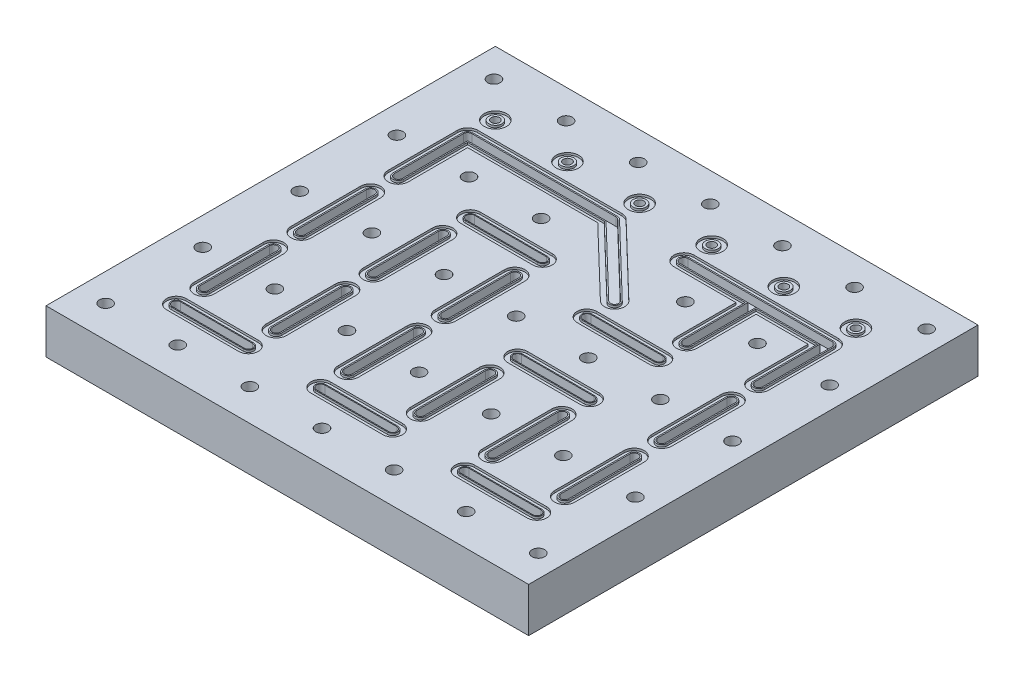
from build123d import *

# Parameters (mm, degrees)
SKETCH1_W                                            = 276.225
SKETCH1_H                                            = 257.175
BOSS_EXTRUDE1_DEPTH                                  = 25.4
SKETCH66_R                                           = 2.38125
CUT_EXTRUDE15_DEPTH                                  = 4.7625
SKETCH67_R                                           = 6.4008
SKETCH67_R_2                                         = 3.7338
CUT_EXTRUDE16_DEPTH                                  = 1.2446
CBORE_FOR_1_4_BINDING_HEAD_MACHINE_SCREW_D           = 7.14248
CBORE_FOR_1_4_BINDING_HEAD_MACHINE_SCREW_CBORE_D     = 14.2875
CBORE_FOR_1_4_BINDING_HEAD_MACHINE_SCREW_CBORE_DEPTH = 4.191


with BuildPart() as part:
    # Sketch1 → Boss-Extrude1 (new body)
    with BuildSketch(Plane(origin=(0, 0, 0), x_dir=(1, 0, 0), z_dir=(0, 1, 0))):
        Rectangle(SKETCH1_W, SKETCH1_H)
    extrude(amount=BOSS_EXTRUDE1_DEPTH)

    # Sketch66 → Cut-Extrude15 (cut)
    with BuildSketch(Plane(origin=(0, 25.4, 0), x_dir=(1, 0, 0), z_dir=(0, 1, 0))):
        with BuildLine():
            Line((-20.009108216, 73.81875), (20.574534869, 34.796016264))
            ThreePointArc((20.574534869, 34.796016264), (23.941483736, 34.862034869), (23.875465131, 38.228983736))
            Line((23.875465131, 38.228983736), (-17.399534869, 77.916483736))
            ThreePointArc((-17.399534869, 77.916483736), (-18.160344261, 78.408815119), (-19.05, 78.58125))
            Line((-19.05, 78.58125), (-101.6, 78.58125))
            ThreePointArc((-101.6, 78.58125), (-103.283798023, 77.883798023), (-103.98125, 76.2))
            Line((-103.98125, 76.2), (-103.98125, 36.5125))
            ThreePointArc((-103.98125, 36.5125), (-101.6, 34.13125), (-99.21875, 36.5125))
            Line((-99.21875, 36.5125), (-99.21875, 73.81875))
            Line((-99.21875, 73.81875), (-20.009108216, 73.81875))
        make_face()
        with BuildLine():
            ThreePointArc((-99.21875, 20.6375), (-101.6, 23.01875), (-103.98125, 20.6375))
            Line((-103.98125, 20.6375), (-103.98125, -19.05))
            ThreePointArc((-103.98125, -19.05), (-101.6, -21.43125), (-99.21875, -19.05))
            Line((-99.21875, -19.05), (-99.21875, 20.6375))
        make_face()
        with BuildLine():
            ThreePointArc((-99.21875, -34.925), (-101.6, -32.54375), (-103.98125, -34.925))
            Line((-103.98125, -34.925), (-103.98125, -74.6125))
            ThreePointArc((-103.98125, -74.6125), (-101.6, -76.99375), (-99.21875, -74.6125))
            Line((-99.21875, -74.6125), (-99.21875, -34.925))
        make_face()
        with BuildLine():
            Line((-60.325, -88.10625), (-101.6, -88.10625))
            ThreePointArc((-101.6, -88.10625), (-103.98125, -90.4875), (-101.6, -92.86875))
            Line((-101.6, -92.86875), (-60.325, -92.86875))
            ThreePointArc((-60.325, -92.86875), (-57.94375, -90.4875), (-60.325, -88.10625))
        make_face()
        with BuildLine():
            Line((-62.70625, -34.925), (-62.70625, -74.6125))
            ThreePointArc((-62.70625, -74.6125), (-60.325, -76.99375), (-57.94375, -74.6125))
            Line((-57.94375, -74.6125), (-57.94375, -34.925))
            ThreePointArc((-57.94375, -34.925), (-60.325, -32.54375), (-62.70625, -34.925))
        make_face()
        with BuildLine():
            Line((-62.70625, 20.6375), (-62.70625, -19.05))
            ThreePointArc((-62.70625, -19.05), (-60.325, -21.43125), (-57.94375, -19.05))
            Line((-57.94375, -19.05), (-57.94375, 20.6375))
            ThreePointArc((-57.94375, 20.6375), (-60.325, 23.01875), (-62.70625, 20.6375))
        make_face()
        with BuildLine():
            Line((-19.05, 38.89375), (-60.325, 38.89375))
            ThreePointArc((-60.325, 38.89375), (-62.70625, 36.5125), (-60.325, 34.13125))
            Line((-60.325, 34.13125), (-19.05, 34.13125))
            ThreePointArc((-19.05, 34.13125), (-16.66875, 36.5125), (-19.05, 38.89375))
        make_face()
        with BuildLine():
            ThreePointArc((-16.66875, 20.6375), (-19.05, 23.01875), (-21.43125, 20.6375))
            Line((-21.43125, 20.6375), (-21.43125, -19.05))
            ThreePointArc((-21.43125, -19.05), (-19.05, -21.43125), (-16.66875, -19.05))
            Line((-16.66875, -19.05), (-16.66875, 20.6375))
        make_face()
        with BuildLine():
            ThreePointArc((-16.66875, -34.925), (-19.05, -32.54375), (-21.43125, -34.925))
            Line((-21.43125, -34.925), (-21.43125, -74.6125))
            ThreePointArc((-21.43125, -74.6125), (-19.05, -76.99375), (-16.66875, -74.6125))
            Line((-16.66875, -74.6125), (-16.66875, -34.925))
        make_face()
        with BuildLine():
            Line((22.225, -88.10625), (-19.05, -88.10625))
            ThreePointArc((-19.05, -88.10625), (-21.43125, -90.4875), (-19.05, -92.86875))
            Line((-19.05, -92.86875), (22.225, -92.86875))
            ThreePointArc((22.225, -92.86875), (24.60625, -90.4875), (22.225, -88.10625))
        make_face()
        with BuildLine():
            Line((19.84375, -34.925), (19.84375, -74.6125))
            ThreePointArc((19.84375, -74.6125), (22.225, -76.99375), (24.60625, -74.6125))
            Line((24.60625, -74.6125), (24.60625, -34.925))
            ThreePointArc((24.60625, -34.925), (22.225, -32.54375), (19.84375, -34.925))
        make_face()
        with BuildLine():
            ThreePointArc((65.88125, -34.925), (63.5, -32.54375), (61.11875, -34.925))
            Line((61.11875, -34.925), (61.11875, -74.6125))
            ThreePointArc((61.11875, -74.6125), (63.5, -76.99375), (65.88125, -74.6125))
            Line((65.88125, -74.6125), (65.88125, -34.925))
        make_face()
        with BuildLine():
            Line((63.5, -16.66875), (22.225, -16.66875))
            ThreePointArc((22.225, -16.66875), (19.84375, -19.05), (22.225, -21.43125))
            Line((22.225, -21.43125), (63.5, -21.43125))
            ThreePointArc((63.5, -21.43125), (65.88125, -19.05), (63.5, -16.66875))
        make_face()
        with BuildLine():
            Line((104.775, -88.10625), (63.5, -88.10625))
            ThreePointArc((63.5, -88.10625), (61.11875, -90.4875), (63.5, -92.86875))
            Line((63.5, -92.86875), (104.775, -92.86875))
            ThreePointArc((104.775, -92.86875), (107.15625, -90.4875), (104.775, -88.10625))
        make_face()
        with BuildLine():
            Line((102.39375, -34.925), (102.39375, -74.6125))
            ThreePointArc((102.39375, -74.6125), (104.775, -76.99375), (107.15625, -74.6125))
            Line((107.15625, -74.6125), (107.15625, -34.925))
            ThreePointArc((107.15625, -34.925), (104.775, -32.54375), (102.39375, -34.925))
        make_face()
        with BuildLine():
            Line((102.39375, 20.6375), (102.39375, -19.05))
            ThreePointArc((102.39375, -19.05), (104.775, -21.43125), (107.15625, -19.05))
            Line((107.15625, -19.05), (107.15625, 20.6375))
            ThreePointArc((107.15625, 20.6375), (104.775, 23.01875), (102.39375, 20.6375))
        make_face()
        with BuildLine():
            Line((102.39375, 73.81875), (102.39375, 36.5125))
            ThreePointArc((102.39375, 36.5125), (104.775, 34.13125), (107.15625, 36.5125))
            Line((107.15625, 36.5125), (107.15625, 76.2))
            ThreePointArc((107.15625, 76.2), (106.458798023, 77.883798023), (104.775, 78.58125))
            Line((104.775, 78.58125), (22.225, 78.58125))
            ThreePointArc((22.225, 78.58125), (19.84375, 76.2), (22.225, 73.81875))
            Line((22.225, 73.81875), (61.11875, 73.81875))
            Line((61.11875, 73.81875), (61.11875, 36.5125))
            ThreePointArc((61.11875, 36.5125), (63.5, 34.13125), (65.88125, 36.5125))
            Line((65.88125, 36.5125), (65.88125, 73.81875))
            Line((65.88125, 73.81875), (102.39375, 73.81875))
        make_face()
        with BuildLine():
            ThreePointArc((63.5, 18.25625), (65.88125, 20.6375), (63.5, 23.01875))
            Line((63.5, 23.01875), (22.225, 23.01875))
            ThreePointArc((22.225, 23.01875), (19.84375, 20.6375), (22.225, 18.25625))
            Line((22.225, 18.25625), (63.5, 18.25625))
        make_face()
        with Locations((104.775, 92.075)):
            Circle(SKETCH66_R)
        with Locations((63.5, 92.075)):
            Circle(SKETCH66_R)
        with Locations((22.225, 92.075)):
            Circle(SKETCH66_R)
        with Locations((-19.05, 92.075)):
            Circle(SKETCH66_R)
        with Locations((-60.325, 92.075)):
            Circle(SKETCH66_R)
        with Locations((-101.6, 92.075)):
            Circle(SKETCH66_R)
    extrude(amount=-CUT_EXTRUDE15_DEPTH, mode=Mode.SUBTRACT)

    # Sketch67 → Cut-Extrude16 (cut)
    # profile 1 of 24: a face of its own
    with BuildSketch(Plane(origin=(0, 25.4, 0), x_dir=(1, 0, 0), z_dir=(0, 1, 0))):
        with BuildLine():
            ThreePointArc((-95.84055, 20.6375), (-101.6, 26.39695), (-107.35945, 20.6375))
            Line((-107.35945, 20.6375), (-107.35945, -19.05))
            ThreePointArc((-107.35945, -19.05), (-101.6, -24.80945), (-95.84055, -19.05))
            Line((-95.84055, -19.05), (-95.84055, 20.6375))
        make_face()
        with BuildLine():
            Line((-98.50755, 20.6375), (-98.50755, -19.05))
            ThreePointArc((-98.50755, -19.05), (-101.6, -22.14245), (-104.69245, -19.05))
            Line((-104.69245, -19.05), (-104.69245, 20.6375))
            ThreePointArc((-104.69245, 20.6375), (-101.6, 23.72995), (-98.50755, 20.6375))
        make_face(mode=Mode.SUBTRACT)
    # profile 2 of 24: a face of its own
    with BuildSketch(Plane(origin=(0, 25.4, 0), x_dir=(1, 0, 0), z_dir=(0, 1, 0))):
        with BuildLine():
            ThreePointArc((-54.56555, 20.6375), (-60.325, 26.39695), (-66.08445, 20.6375))
            Line((-66.08445, 20.6375), (-66.08445, -19.05))
            ThreePointArc((-66.08445, -19.05), (-60.325, -24.80945), (-54.56555, -19.05))
            Line((-54.56555, -19.05), (-54.56555, 20.6375))
        make_face()
        with BuildLine():
            Line((-57.23255, 20.6375), (-57.23255, -19.05))
            ThreePointArc((-57.23255, -19.05), (-60.325, -22.14245), (-63.41745, -19.05))
            Line((-63.41745, -19.05), (-63.41745, 20.6375))
            ThreePointArc((-63.41745, 20.6375), (-60.325, 23.72995), (-57.23255, 20.6375))
        make_face(mode=Mode.SUBTRACT)
    # profile 3 of 24: a face of its own
    with BuildSketch(Plane(origin=(0, 25.4, 0), x_dir=(1, 0, 0), z_dir=(0, 1, 0))):
        with BuildLine():
            ThreePointArc((-13.29055, 20.6375), (-19.05, 26.39695), (-24.80945, 20.6375))
            Line((-24.80945, 20.6375), (-24.80945, -19.05))
            ThreePointArc((-24.80945, -19.05), (-19.05, -24.80945), (-13.29055, -19.05))
            Line((-13.29055, -19.05), (-13.29055, 20.6375))
        make_face()
        with BuildLine():
            Line((-15.95755, 20.6375), (-15.95755, -19.05))
            ThreePointArc((-15.95755, -19.05), (-19.05, -22.14245), (-22.14245, -19.05))
            Line((-22.14245, -19.05), (-22.14245, 20.6375))
            ThreePointArc((-22.14245, 20.6375), (-19.05, 23.72995), (-15.95755, 20.6375))
        make_face(mode=Mode.SUBTRACT)
    # profile 4 of 24: a face of its own
    with BuildSketch(Plane(origin=(0, 25.4, 0), x_dir=(1, 0, 0), z_dir=(0, 1, 0))):
        with BuildLine():
            ThreePointArc((-60.325, 42.09415), (-65.90665, 36.5125), (-60.325, 30.93085))
            Line((-60.325, 30.93085), (-19.05, 30.93085))
            ThreePointArc((-19.05, 30.93085), (-13.46835, 36.5125), (-19.05, 42.09415))
            Line((-19.05, 42.09415), (-60.325, 42.09415))
        make_face()
        with BuildLine():
            Line((-60.325, 39.42715), (-19.05, 39.42715))
            ThreePointArc((-19.05, 39.42715), (-16.13535, 36.5125), (-19.05, 33.59785))
            Line((-19.05, 33.59785), (-60.325, 33.59785))
            ThreePointArc((-60.325, 33.59785), (-63.23965, 36.5125), (-60.325, 39.42715))
        make_face(mode=Mode.SUBTRACT)
    # profile 5 of 24: a face of its own
    with BuildSketch(Plane(origin=(0, 25.4, 0), x_dir=(1, 0, 0), z_dir=(0, 1, 0))):
        with BuildLine():
            ThreePointArc((22.225, 26.21915), (16.64335, 20.6375), (22.225, 15.05585))
            Line((22.225, 15.05585), (63.5, 15.05585))
            ThreePointArc((63.5, 15.05585), (69.08165, 20.6375), (63.5, 26.21915))
            Line((63.5, 26.21915), (22.225, 26.21915))
        make_face()
        with BuildLine():
            Line((63.5, 17.72285), (22.225, 17.72285))
            ThreePointArc((22.225, 17.72285), (19.31035, 20.6375), (22.225, 23.55215))
            Line((22.225, 23.55215), (63.5, 23.55215))
            ThreePointArc((63.5, 23.55215), (66.41465, 20.6375), (63.5, 17.72285))
        make_face(mode=Mode.SUBTRACT)
    # profile 6 of 24: a face of its own
    with BuildSketch(Plane(origin=(0, 25.4, 0), x_dir=(1, 0, 0), z_dir=(0, 1, 0))):
        with BuildLine():
            ThreePointArc((63.5, -24.63165), (69.08165, -19.05), (63.5, -13.46835))
            Line((63.5, -13.46835), (22.225, -13.46835))
            ThreePointArc((22.225, -13.46835), (16.64335, -19.05), (22.225, -24.63165))
            Line((22.225, -24.63165), (63.5, -24.63165))
        make_face()
        with BuildLine():
            Line((63.5, -21.96465), (22.225, -21.96465))
            ThreePointArc((22.225, -21.96465), (19.31035, -19.05), (22.225, -16.13535))
            Line((22.225, -16.13535), (63.5, -16.13535))
            ThreePointArc((63.5, -16.13535), (66.41465, -19.05), (63.5, -21.96465))
        make_face(mode=Mode.SUBTRACT)
    # profile 7 of 24: a face of its own
    with BuildSketch(Plane(origin=(0, 25.4, 0), x_dir=(1, 0, 0), z_dir=(0, 1, 0))):
        with BuildLine():
            ThreePointArc((110.53445, 20.6375), (104.775, 26.39695), (99.01555, 20.6375))
            Line((99.01555, 20.6375), (99.01555, -19.05))
            ThreePointArc((99.01555, -19.05), (104.775, -24.80945), (110.53445, -19.05))
            Line((110.53445, -19.05), (110.53445, 20.6375))
        make_face()
        with BuildLine():
            Line((107.86745, 20.6375), (107.86745, -19.05))
            ThreePointArc((107.86745, -19.05), (104.775, -22.14245), (101.68255, -19.05))
            Line((101.68255, -19.05), (101.68255, 20.6375))
            ThreePointArc((101.68255, 20.6375), (104.775, 23.72995), (107.86745, 20.6375))
        make_face(mode=Mode.SUBTRACT)
    # profile 8 of 24: a face of its own
    with BuildSketch(Plane(origin=(0, 25.4, 0), x_dir=(1, 0, 0), z_dir=(0, 1, 0))):
        with BuildLine():
            ThreePointArc((110.53445, -34.925), (104.775, -29.16555), (99.01555, -34.925))
            Line((99.01555, -34.925), (99.01555, -74.6125))
            ThreePointArc((99.01555, -74.6125), (104.775, -80.37195), (110.53445, -74.6125))
            Line((110.53445, -74.6125), (110.53445, -34.925))
        make_face()
        with BuildLine():
            Line((101.68255, -74.6125), (101.68255, -34.925))
            ThreePointArc((101.68255, -34.925), (104.775, -31.83255), (107.86745, -34.925))
            Line((107.86745, -34.925), (107.86745, -74.6125))
            ThreePointArc((107.86745, -74.6125), (104.775, -77.70495), (101.68255, -74.6125))
        make_face(mode=Mode.SUBTRACT)
    # profile 9 of 24: a face of its own
    with BuildSketch(Plane(origin=(0, 25.4, 0), x_dir=(1, 0, 0), z_dir=(0, 1, 0))):
        with BuildLine():
            ThreePointArc((57.74055, -74.6125), (63.5, -80.37195), (69.25945, -74.6125))
            Line((69.25945, -74.6125), (69.25945, -34.925))
            ThreePointArc((69.25945, -34.925), (63.5, -29.16555), (57.74055, -34.925))
            Line((57.74055, -34.925), (57.74055, -74.6125))
        make_face()
        with BuildLine():
            Line((66.59245, -34.925), (66.59245, -74.6125))
            ThreePointArc((66.59245, -74.6125), (63.5, -77.70495), (60.40755, -74.6125))
            Line((60.40755, -74.6125), (60.40755, -34.925))
            ThreePointArc((60.40755, -34.925), (63.5, -31.83255), (66.59245, -34.925))
        make_face(mode=Mode.SUBTRACT)
    # profile 10 of 24: a face of its own
    with BuildSketch(Plane(origin=(0, 25.4, 0), x_dir=(1, 0, 0), z_dir=(0, 1, 0))):
        with BuildLine():
            ThreePointArc((104.775, -96.06915), (110.35665, -90.4875), (104.775, -84.90585))
            Line((104.775, -84.90585), (63.5, -84.90585))
            ThreePointArc((63.5, -84.90585), (57.91835, -90.4875), (63.5, -96.06915))
            Line((63.5, -96.06915), (104.775, -96.06915))
        make_face()
        with BuildLine():
            Line((63.5, -87.57285), (104.775, -87.57285))
            ThreePointArc((104.775, -87.57285), (107.68965, -90.4875), (104.775, -93.40215))
            Line((104.775, -93.40215), (63.5, -93.40215))
            ThreePointArc((63.5, -93.40215), (60.58535, -90.4875), (63.5, -87.57285))
        make_face(mode=Mode.SUBTRACT)
    # profile 11 of 24: a face of its own
    with BuildSketch(Plane(origin=(0, 25.4, 0), x_dir=(1, 0, 0), z_dir=(0, 1, 0))):
        with BuildLine():
            ThreePointArc((22.225, -96.06915), (27.80665, -90.4875), (22.225, -84.90585))
            Line((22.225, -84.90585), (-19.05, -84.90585))
            ThreePointArc((-19.05, -84.90585), (-24.63165, -90.4875), (-19.05, -96.06915))
            Line((-19.05, -96.06915), (22.225, -96.06915))
        make_face()
        with BuildLine():
            Line((-19.05, -87.57285), (22.225, -87.57285))
            ThreePointArc((22.225, -87.57285), (25.13965, -90.4875), (22.225, -93.40215))
            Line((22.225, -93.40215), (-19.05, -93.40215))
            ThreePointArc((-19.05, -93.40215), (-21.96465, -90.4875), (-19.05, -87.57285))
        make_face(mode=Mode.SUBTRACT)
    # profile 12 of 24: a face of its own
    with BuildSketch(Plane(origin=(0, 25.4, 0), x_dir=(1, 0, 0), z_dir=(0, 1, 0))):
        with BuildLine():
            ThreePointArc((16.46555, -74.6125), (22.225, -80.37195), (27.98445, -74.6125))
            Line((27.98445, -74.6125), (27.98445, -34.925))
            ThreePointArc((27.98445, -34.925), (22.225, -29.16555), (16.46555, -34.925))
            Line((16.46555, -34.925), (16.46555, -74.6125))
        make_face()
        with BuildLine():
            Line((19.13255, -74.6125), (19.13255, -34.925))
            ThreePointArc((19.13255, -34.925), (22.225, -31.83255), (25.31745, -34.925))
            Line((25.31745, -34.925), (25.31745, -74.6125))
            ThreePointArc((25.31745, -74.6125), (22.225, -77.70495), (19.13255, -74.6125))
        make_face(mode=Mode.SUBTRACT)
    # profile 13 of 24: a face of its own
    with BuildSketch(Plane(origin=(0, 25.4, 0), x_dir=(1, 0, 0), z_dir=(0, 1, 0))):
        with BuildLine():
            ThreePointArc((-13.29055, -34.925), (-19.05, -29.16555), (-24.80945, -34.925))
            Line((-24.80945, -34.925), (-24.80945, -74.6125))
            ThreePointArc((-24.80945, -74.6125), (-19.05, -80.37195), (-13.29055, -74.6125))
            Line((-13.29055, -74.6125), (-13.29055, -34.925))
        make_face()
        with BuildLine():
            Line((-15.95755, -34.925), (-15.95755, -74.6125))
            ThreePointArc((-15.95755, -74.6125), (-19.05, -77.70495), (-22.14245, -74.6125))
            Line((-22.14245, -74.6125), (-22.14245, -34.925))
            ThreePointArc((-22.14245, -34.925), (-19.05, -31.83255), (-15.95755, -34.925))
        make_face(mode=Mode.SUBTRACT)
    # profile 14 of 24: a face of its own
    with BuildSketch(Plane(origin=(0, 25.4, 0), x_dir=(1, 0, 0), z_dir=(0, 1, 0))):
        with BuildLine():
            ThreePointArc((-60.325, -96.06915), (-54.74335, -90.4875), (-60.325, -84.90585))
            Line((-60.325, -84.90585), (-101.6, -84.90585))
            ThreePointArc((-101.6, -84.90585), (-107.18165, -90.4875), (-101.6, -96.06915))
            Line((-101.6, -96.06915), (-60.325, -96.06915))
        make_face()
        with BuildLine():
            Line((-101.6, -87.57285), (-60.325, -87.57285))
            ThreePointArc((-60.325, -87.57285), (-57.41035, -90.4875), (-60.325, -93.40215))
            Line((-60.325, -93.40215), (-101.6, -93.40215))
            ThreePointArc((-101.6, -93.40215), (-104.51465, -90.4875), (-101.6, -87.57285))
        make_face(mode=Mode.SUBTRACT)
    # profile 15 of 24: a face of its own
    with BuildSketch(Plane(origin=(0, 25.4, 0), x_dir=(1, 0, 0), z_dir=(0, 1, 0))):
        with BuildLine():
            ThreePointArc((-107.35945, -74.6125), (-101.6, -80.37195), (-95.84055, -74.6125))
            Line((-95.84055, -74.6125), (-95.84055, -34.925))
            ThreePointArc((-95.84055, -34.925), (-101.6, -29.16555), (-107.35945, -34.925))
            Line((-107.35945, -34.925), (-107.35945, -74.6125))
        make_face()
        with BuildLine():
            Line((-98.50755, -34.925), (-98.50755, -74.6125))
            ThreePointArc((-98.50755, -74.6125), (-101.6, -77.70495), (-104.69245, -74.6125))
            Line((-104.69245, -74.6125), (-104.69245, -34.925))
            ThreePointArc((-104.69245, -34.925), (-101.6, -31.83255), (-98.50755, -34.925))
        make_face(mode=Mode.SUBTRACT)
    # profile 16 of 24: a face of its own
    with BuildSketch(Plane(origin=(0, 25.4, 0), x_dir=(1, 0, 0), z_dir=(0, 1, 0))):
        with BuildLine():
            ThreePointArc((-54.56555, -34.925), (-60.325, -29.16555), (-66.08445, -34.925))
            Line((-66.08445, -34.925), (-66.08445, -74.6125))
            ThreePointArc((-66.08445, -74.6125), (-60.325, -80.37195), (-54.56555, -74.6125))
            Line((-54.56555, -74.6125), (-54.56555, -34.925))
        make_face()
        with BuildLine():
            Line((-57.23255, -34.925), (-57.23255, -74.6125))
            ThreePointArc((-57.23255, -74.6125), (-60.325, -77.70495), (-63.41745, -74.6125))
            Line((-63.41745, -74.6125), (-63.41745, -34.925))
            ThreePointArc((-63.41745, -34.925), (-60.325, -31.83255), (-57.23255, -34.925))
        make_face(mode=Mode.SUBTRACT)
    # profile 17 of 24: a face of its own
    with BuildSketch(Plane(origin=(0, 25.4, 0), x_dir=(1, 0, 0), z_dir=(0, 1, 0))):
        with BuildLine():
            ThreePointArc((-107.35945, 36.5125), (-101.6, 30.75305), (-95.84055, 36.5125))
            Line((-95.84055, 36.5125), (-95.84055, 70.44055))
            Line((-95.84055, 70.44055), (-21.369763071, 70.44055))
            Line((-21.369763071, 70.44055), (18.233075004, 32.360898004))
            ThreePointArc((18.233075004, 32.360898004), (26.376601996, 32.520575004), (26.216924996, 40.664101996))
            Line((26.216924996, 40.664101996), (-15.058075004, 80.351601996))
            ThreePointArc((-15.058075004, 80.351601996), (-16.89821932, 81.542387501), (-19.05, 81.95945))
            Line((-19.05, 81.95945), (-101.6, 81.95945))
            ThreePointArc((-101.6, 81.95945), (-105.672546151, 80.272546151), (-107.35945, 76.2))
            Line((-107.35945, 76.2), (-107.35945, 36.5125))
        make_face()
        with BuildLine():
            Line((-101.6, 79.29245), (-19.05, 79.29245))
            ThreePointArc((-19.05, 79.29245), (-17.894633747, 79.068514568), (-16.90659595, 78.429140212))
            Line((-16.90659595, 78.429140212), (24.36840405, 38.741640212))
            ThreePointArc((24.36840405, 38.741640212), (24.454140212, 34.36909595), (20.08159595, 34.283359788))
            Line((20.08159595, 34.283359788), (-20.29556187, 73.10755))
            Line((-20.29556187, 73.10755), (-98.50755, 73.10755))
            Line((-98.50755, 73.10755), (-98.50755, 36.5125))
            ThreePointArc((-98.50755, 36.5125), (-101.6, 33.42005), (-104.69245, 36.5125))
            Line((-104.69245, 36.5125), (-104.69245, 76.2))
            ThreePointArc((-104.69245, 76.2), (-103.786692365, 78.386692365), (-101.6, 79.29245))
        make_face(mode=Mode.SUBTRACT)
    # profile 18 of 24: a face of its own
    with BuildSketch(Plane(origin=(0, 25.4, 0), x_dir=(1, 0, 0), z_dir=(0, 1, 0))):
        with BuildLine():
            ThreePointArc((22.225, 81.95945), (16.46555, 76.2), (22.225, 70.44055))
            Line((22.225, 70.44055), (57.74055, 70.44055))
            Line((57.74055, 70.44055), (57.74055, 36.5125))
            ThreePointArc((57.74055, 36.5125), (63.5, 30.75305), (69.25945, 36.5125))
            Line((69.25945, 36.5125), (69.25945, 70.44055))
            Line((69.25945, 70.44055), (99.01555, 70.44055))
            Line((99.01555, 70.44055), (99.01555, 36.5125))
            ThreePointArc((99.01555, 36.5125), (104.775, 30.75305), (110.53445, 36.5125))
            Line((110.53445, 36.5125), (110.53445, 76.2))
            ThreePointArc((110.53445, 76.2), (108.847546151, 80.272546151), (104.775, 81.95945))
            Line((104.775, 81.95945), (22.225, 81.95945))
        make_face()
        with BuildLine():
            Line((22.225, 79.29245), (104.775, 79.29245))
            ThreePointArc((104.775, 79.29245), (106.961692365, 78.386692365), (107.86745, 76.2))
            Line((107.86745, 76.2), (107.86745, 36.5125))
            ThreePointArc((107.86745, 36.5125), (104.775, 33.42005), (101.68255, 36.5125))
            Line((101.68255, 36.5125), (101.68255, 73.10755))
            Line((101.68255, 73.10755), (66.59245, 73.10755))
            Line((66.59245, 73.10755), (66.59245, 36.5125))
            ThreePointArc((66.59245, 36.5125), (63.5, 33.42005), (60.40755, 36.5125))
            Line((60.40755, 36.5125), (60.40755, 73.10755))
            Line((60.40755, 73.10755), (22.225, 73.10755))
            ThreePointArc((22.225, 73.10755), (19.13255, 76.2), (22.225, 79.29245))
        make_face(mode=Mode.SUBTRACT)
    # profile 19 of 24: a face of its own
    with BuildSketch(Plane(origin=(0, 25.4, 0), x_dir=(1, 0, 0), z_dir=(0, 1, 0))):
        with Locations((-60.325, 92.075)):
            Circle(SKETCH67_R)
        with Locations((-60.325, 92.075)):
            Circle(SKETCH67_R_2, mode=Mode.SUBTRACT)
    # profile 20 of 24: a face of its own
    with BuildSketch(Plane(origin=(0, 25.4, 0), x_dir=(1, 0, 0), z_dir=(0, 1, 0))):
        with Locations((-19.05, 92.075)):
            Circle(SKETCH67_R)
        with Locations((-19.05, 92.075)):
            Circle(SKETCH67_R_2, mode=Mode.SUBTRACT)
    # profile 21 of 24: a face of its own
    with BuildSketch(Plane(origin=(0, 25.4, 0), x_dir=(1, 0, 0), z_dir=(0, 1, 0))):
        with Locations((22.225, 92.075)):
            Circle(SKETCH67_R)
        with Locations((22.225, 92.075)):
            Circle(SKETCH67_R_2, mode=Mode.SUBTRACT)
    # profile 22 of 24: a face of its own
    with BuildSketch(Plane(origin=(0, 25.4, 0), x_dir=(1, 0, 0), z_dir=(0, 1, 0))):
        with Locations((63.5, 92.075)):
            Circle(SKETCH67_R)
        with Locations((63.5, 92.075)):
            Circle(SKETCH67_R_2, mode=Mode.SUBTRACT)
    # profile 23 of 24: a face of its own
    with BuildSketch(Plane(origin=(0, 25.4, 0), x_dir=(1, 0, 0), z_dir=(0, 1, 0))):
        with Locations((104.775, 92.075)):
            Circle(SKETCH67_R)
        with Locations((104.775, 92.075)):
            Circle(SKETCH67_R_2, mode=Mode.SUBTRACT)
    # profile 24 of 24: a face of its own
    with BuildSketch(Plane(origin=(0, 25.4, 0), x_dir=(1, 0, 0), z_dir=(0, 1, 0))):
        with Locations((-101.6, 92.075)):
            Circle(SKETCH67_R)
        with Locations((-101.6, 92.075)):
            Circle(SKETCH67_R_2, mode=Mode.SUBTRACT)
    extrude(amount=-CUT_EXTRUDE16_DEPTH, mode=Mode.SUBTRACT)

    # CBORE for 1_4 Binding Head Machine Screw (through all)
    with Locations(Plane.XZ):
        with Locations((125.4125, -0.79375), (-80.9625, 54.76875), (-80.9625, -0.79375), (-80.9625, -56.35625), (-39.6875, -56.35625), (-39.6875, -0.79375), (-39.6875, 54.76875), (1.5875, -0.79375), (1.5875, 54.76875), (42.8625, 54.76875), (42.8625, -0.79375), (42.8625, -56.35625), (84.1375, -56.35625), (84.1375, -0.79375), (84.1375, 54.76875), (-39.6875, -111.91875), (-39.6875, 110.33125), (-80.9625, -111.91875), (1.5875, -111.91875), (42.8625, -111.91875), (84.1375, -111.91875), (-80.9625, 110.33125), (1.5875, 110.33125), (42.8625, 110.33125), (84.1375, 110.33125), (125.4125, 110.33125), (125.4125, -111.91875), (-122.2375, -111.91875), (-122.2375, 110.33125), (125.4125, 54.76875), (-122.2375, 54.76875), (-122.2375, -0.79375), (-122.2375, -56.35625), (125.4125, -56.35625)):
            CounterBoreHole(CBORE_FOR_1_4_BINDING_HEAD_MACHINE_SCREW_D / 2, CBORE_FOR_1_4_BINDING_HEAD_MACHINE_SCREW_CBORE_D / 2, CBORE_FOR_1_4_BINDING_HEAD_MACHINE_SCREW_CBORE_DEPTH)


solid = part.part
